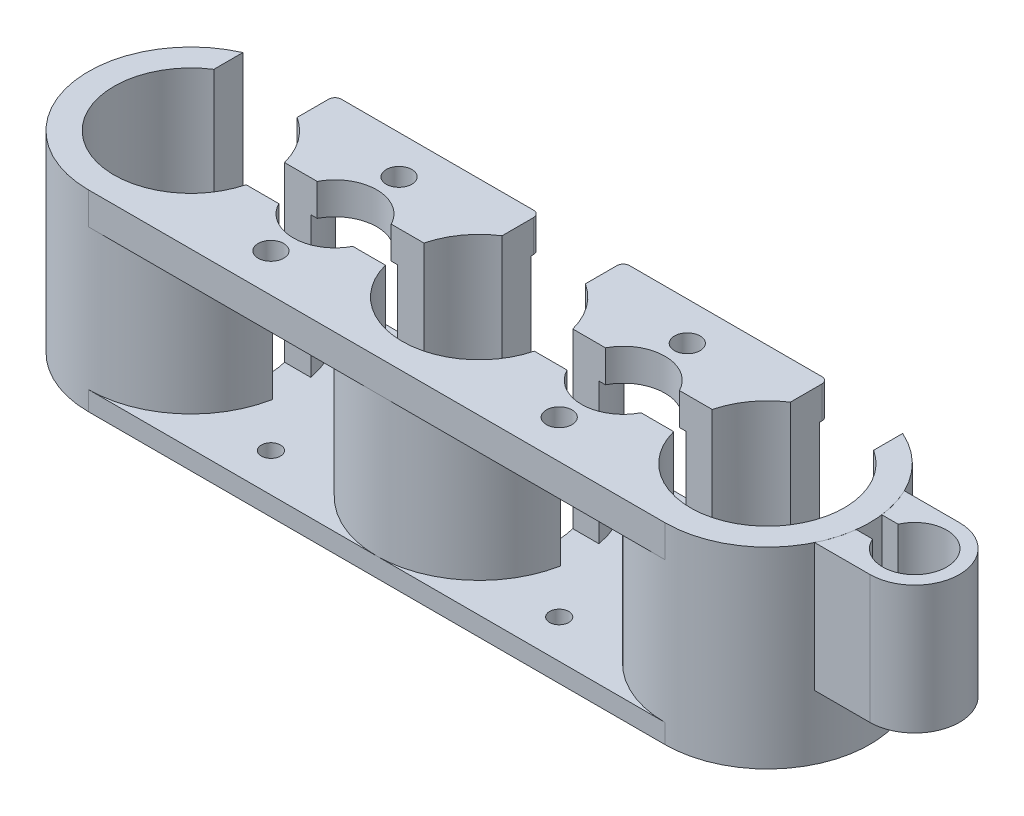
from build123d import *

# Parameters (mm, degrees)
SKETCH1_R               = 16
SKETCH1_R_2             = 12
BOSS_EXTRUDE1_DEPTH     = 30
BOSS_EXTRUDE1_2_DEPTH   = 30
BOSS_EXTRUDE1_3_DEPTH   = 30
BOSS_EXTRUDE2_DEPTH     = 3
BOSS_EXTRUDE3_DEPTH     = 20
SKETCH5_R               = 1.5
CUT_EXTRUDE4_DEPTH      = 10
BOSS_EXTRUDE4_START     = -5
BOSS_EXTRUDE4_OUTLINE_R = 2
BOSS_EXTRUDE4_DEPTH     = 5
LPATTERN6_COUNT         = 2
LPATTERN6_PITCH         = 45
SKETCH6_W               = 13
SKETCH6_H               = 20
SKETCH6_W_2             = 77
SKETCH6_H_2             = 6
CUT_EXTRUDE6_DEPTH      = 27
FILLET20_R              = 1
FILLET21_R              = 6


# Read off the part's stored shape, not the designer's step: Boss-Extrude4
with BuildPart() as part:
    # Sketch1 → Boss-Extrude1 (new body)
    with BuildSketch(Plane(origin=(0, 0, 0), x_dir=(1, 0, 0), z_dir=(0, 1, 0))):
        with Locations(Location((0, 0, 0), (0, 0, 270))):
            Circle(SKETCH1_R)
        with Locations(Location((0, 0, 0), (0, 0, 270))):
            Circle(SKETCH1_R_2, mode=Mode.SUBTRACT)
    extrude(amount=BOSS_EXTRUDE1_DEPTH)



with BuildPart() as body_2:
    # Sketch1 → Boss-Extrude1 2 (new body)
    with BuildSketch(Plane(origin=(0, 0, 0), x_dir=(1, 0, 0), z_dir=(0, 1, 0))):
        with Locations(Location((-45, 0, 0), (0, 0, 270))):
            Circle(SKETCH1_R)
        with Locations(Location((-45, 0, 0), (0, 0, 270))):
            Circle(SKETCH1_R_2, mode=Mode.SUBTRACT)
    extrude(amount=BOSS_EXTRUDE1_2_DEPTH)


with BuildPart() as body_3:
    # Sketch1 → Boss-Extrude1 3 (new body)
    with BuildSketch(Plane(origin=(0, 0, 0), x_dir=(1, 0, 0), z_dir=(0, 1, 0))):
        with Locations(Location((-90, 0, 0), (0, 0, 270))):
            Circle(SKETCH1_R)
        with Locations(Location((-90, 0, 0), (0, 0, 270))):
            Circle(SKETCH1_R_2, mode=Mode.SUBTRACT)
    extrude(amount=BOSS_EXTRUDE1_3_DEPTH)


with BuildPart() as part_1:
    add(part.part)

    add(body_2.part)  # Boss-Extrude2 merges body 2

    add(body_3.part)  # Boss-Extrude2 merges body 3
    # Sketch2 → Boss-Extrude2 (add)
    with BuildSketch(Plane(origin=(0, 0, 0), x_dir=(1, 0, 0), z_dir=(0, 1, 0))):
        with BuildLine():
            Line((-61, 0), (-74, 0))
            ThreePointArc((-74, 0), (-78.686291501, -11.313708499), (-90, -16))
            Line((-90, -16), (-45, -16))
            ThreePointArc((-45, -16), (-56.313708499, -11.313708499), (-61, 0))
        make_face()
        with BuildLine():
            Line((0, 16), (-45, 16))
            ThreePointArc((-45, 16), (-33.686291501, 11.313708499), (-29, 0))
            Line((-29, 0), (-16, 0))
            ThreePointArc((-16, 0), (-11.313708499, 11.313708499), (0, 16))
        make_face()
        with BuildLine():
            ThreePointArc((-29, 0), (-33.686291501, -11.313708499), (-45, -16))
            Line((-45, -16), (0, -16))
            ThreePointArc((0, -16), (-11.313708499, -11.313708499), (-16, 0))
            Line((-16, 0), (-29, 0))
        make_face()
        with BuildLine():
            ThreePointArc((-90, 16), (-78.686291501, 11.313708499), (-74, 0))
            Line((-74, 0), (-61, 0))
            ThreePointArc((-61, 0), (-56.313708499, 11.313708499), (-45, 16))
            Line((-45, 16), (-90, 16))
        make_face()
    extrude(amount=BOSS_EXTRUDE2_DEPTH)

    # Sketch5 → Cut-Extrude4 (cut)
    with BuildSketch(Plane.XZ):
        with Locations(Location((-67.5, 10, 0), (0, 0, 270))):
            Circle(SKETCH5_R)
        with Locations(Location((-67.5, -10, 0), (0, 0, 90))):
            Circle(SKETCH5_R)
        with Locations(Location((-22.5, -10, 0), (0, 0, 270))):
            Circle(SKETCH5_R)
        with Locations(Location((-22.5, 10, 0), (0, 0, 90))):
            Circle(SKETCH5_R)
    extrude(amount=-CUT_EXTRUDE4_DEPTH, mode=Mode.SUBTRACT)

    # Boss-Extrude4 outline → Boss-Extrude4 (add)
    # profile 1 of 2: a face of its own
    with BuildSketch(Plane(origin=(0, 30, 0), x_dir=(1, 0, 0), z_dir=(0, 1, 0)).offset(BOSS_EXTRUDE4_START)):
        with BuildLine():
            ThreePointArc((-74.000004565, -0.012086763), (-78.690565624, -11.317981008), (-90, -16))
            Line((-90, -16), (-45, -16))
            ThreePointArc((-45, -16), (-56.309434376, -11.317981008), (-60.999995435, -0.012086763))
            ThreePointArc((-60.999995435, -0.012086763), (-67.5, -6.517003435), (-74.000004565, -0.012086763))
        make_face()
        with Locations((-67.5, -10)):
            Circle(BOSS_EXTRUDE4_OUTLINE_R, mode=Mode.SUBTRACT)
    # profile 2 of 2: a face of its own
    with BuildSketch(Plane(origin=(0, 30, 0), x_dir=(1, 0, 0), z_dir=(0, 1, 0)).offset(BOSS_EXTRUDE4_START)):
        with BuildLine():
            Line((-45, 16), (-90, 16))
            ThreePointArc((-90, 16), (-78.690565624, 11.317981008), (-74.000004565, 0.012086763))
            ThreePointArc((-74.000004565, 0.012086763), (-67.5, 6.517003435), (-60.999995435, 0.012086763))
            ThreePointArc((-60.999995435, 0.012086763), (-56.309434376, 11.317981008), (-45, 16))
        make_face()
        with Locations((-67.5, 10)):
            Circle(BOSS_EXTRUDE4_OUTLINE_R, mode=Mode.SUBTRACT)
    boss_extrude4 = extrude(amount=BOSS_EXTRUDE4_DEPTH)

    # LPattern6: Boss-Extrude4 ×2
    with Locations(*[(i * LPATTERN6_PITCH, 0, 0) for i in range(1, LPATTERN6_COUNT)]):
        add(boss_extrude4)

    # Sketch6 → Cut-Extrude6 (cut)
    with BuildSketch(Plane(origin=(0, 30, 0), x_dir=(1, 0, 0), z_dir=(0, 1, 0))):
        with Locations((-45, 10)):
            Rectangle(SKETCH6_W, SKETCH6_H)
        with Locations((0, 10)):
            Rectangle(SKETCH6_W, SKETCH6_H)
        with Locations((-90, 10)):
            Rectangle(SKETCH6_W, SKETCH6_H)
        with Locations((-45, 0)):
            Rectangle(SKETCH6_W_2, SKETCH6_H_2)
    extrude(amount=-CUT_EXTRUDE6_DEPTH, mode=Mode.SUBTRACT)

    # Fillet20
    fillet20_edges = [part_1.edges().sort_by_distance(p)[0] for p in [
        (-51.5, 27.5, -16),
        (-6.5, 27.5, -16),
        (-38.5, 27.5, -16),
        (-83.5, 27.5, -16),
    ]]
    fillet(fillet20_edges, radius=FILLET20_R)

    # Fillet21
    # the kernel refuses this fillet: 6 mm, written as the material it adds along each edge
    with BuildSketch(Plane(origin=(-38.5, 3, 4.912879499), x_dir=(0, 1, 0), z_dir=(0, 0, -1))) as fillet21_piece_1_section:
        with BuildLine():
            CenterArc((FILLET21_R, -FILLET21_R), FILLET21_R, 90, 90)
            Line((0, -FILLET21_R), (0, 0))
            Line((0, 0), (FILLET21_R, 0))
        make_face()
    fillet21_piece_1 = extrude(amount=34.533071016, mode=Mode.PRIVATE)
    fillet21_piece_1 = fillet21_piece_1 - Plane(origin=(-45, 4.386828821, 0), x_dir=(0, 0, 1), z_dir=(0, -1, 0)) * Cylinder(12, 94, mode=Mode.PRIVATE)
    fillet21_piece_1 = fillet21_piece_1 & Plane(origin=(-45, 4.386828821, 0), x_dir=(0, 0, 1), z_dir=(0, -1, 0)) * Cylinder(16, 94, mode=Mode.PRIVATE)
    add(fillet21_piece_1)
    with BuildSketch(Plane(origin=(6.5, 3, 4.912879499), x_dir=(-1, 0, 0), z_dir=(0, 0, -1))) as fillet21_piece_2_section:
        with BuildLine():
            CenterArc((FILLET21_R, FILLET21_R), FILLET21_R, 180, 90)
            Line((0, FILLET21_R), (0, 0))
            Line((0, 0), (FILLET21_R, 0))
        make_face()
    fillet21_piece_2 = extrude(amount=34.533071016, mode=Mode.PRIVATE)
    fillet21_piece_2 = fillet21_piece_2 - Plane(origin=(0, 4.386829335, 0), x_dir=(0, 0, 1), z_dir=(0, -1, 0)) * Cylinder(12, 94, mode=Mode.PRIVATE)
    fillet21_piece_2 = fillet21_piece_2 & Plane(origin=(0, 4.386829335, 0), x_dir=(0, 0, 1), z_dir=(0, -1, 0)) * Cylinder(16, 94, mode=Mode.PRIVATE)
    add(fillet21_piece_2)
    with BuildSketch(Plane(origin=(-83.5, 3, 4.912879499), x_dir=(-1, 0, 0), z_dir=(0, 0, -1))) as fillet21_piece_3_section:
        with BuildLine():
            CenterArc((FILLET21_R, FILLET21_R), FILLET21_R, 180, 90)
            Line((0, FILLET21_R), (0, 0))
            Line((0, 0), (FILLET21_R, 0))
        make_face()
    fillet21_piece_3 = extrude(amount=34.533071016, mode=Mode.PRIVATE)
    fillet21_piece_3 = fillet21_piece_3 - Plane(origin=(-90, 4.386829335, 0), x_dir=(0, 0, 1), z_dir=(0, -1, 0)) * Cylinder(12, 94, mode=Mode.PRIVATE)
    fillet21_piece_3 = fillet21_piece_3 & Plane(origin=(-90, 4.386829335, 0), x_dir=(0, 0, 1), z_dir=(0, -1, 0)) * Cylinder(16, 94, mode=Mode.PRIVATE)
    add(fillet21_piece_3)
    with BuildSketch(Plane(origin=(-96.5, 3, -29.620191517), x_dir=(1, 0, 0), z_dir=(0, 0, 1))) as fillet21_piece_4_section:
        with BuildLine():
            CenterArc((FILLET21_R, FILLET21_R), FILLET21_R, 180, 90)
            Line((0, FILLET21_R), (0, 0))
            Line((0, 0), (FILLET21_R, 0))
        make_face()
    fillet21_piece_4 = extrude(amount=34.533071016, mode=Mode.PRIVATE)
    fillet21_piece_4 = fillet21_piece_4 & Plane(origin=(-90, 4.386829274, 0), x_dir=(0, 0, 1), z_dir=(0, -1, 0)) * Cylinder(16, 94, mode=Mode.PRIVATE)
    fillet21_piece_4 = fillet21_piece_4 - Plane(origin=(-90, 4.386829274, 0), x_dir=(0, 0, 1), z_dir=(0, -1, 0)) * Cylinder(12, 94, mode=Mode.PRIVATE)
    add(fillet21_piece_4)
    with BuildSketch(Plane(origin=(-51.5, 3, -29.620191517), x_dir=(1, 0, 0), z_dir=(0, 0, 1))) as fillet21_piece_5_section:
        with BuildLine():
            CenterArc((FILLET21_R, FILLET21_R), FILLET21_R, 180, 90)
            Line((0, FILLET21_R), (0, 0))
            Line((0, 0), (FILLET21_R, 0))
        make_face()
    fillet21_piece_5 = extrude(amount=34.533071016, mode=Mode.PRIVATE)
    fillet21_piece_5 = fillet21_piece_5 & Plane(origin=(-45, 4.386829361, 0), x_dir=(0, 0, 1), z_dir=(0, -1, 0)) * Cylinder(16, 94, mode=Mode.PRIVATE)
    fillet21_piece_5 = fillet21_piece_5 - Plane(origin=(-45, 4.386829361, 0), x_dir=(0, 0, 1), z_dir=(0, -1, 0)) * Cylinder(12, 94, mode=Mode.PRIVATE)
    add(fillet21_piece_5)
    with BuildSketch(Plane(origin=(-6.5, 3, -29.620191517), x_dir=(0, 1, 0), z_dir=(0, 0, 1))) as fillet21_piece_6_section:
        with BuildLine():
            CenterArc((FILLET21_R, -FILLET21_R), FILLET21_R, 90, 90)
            Line((0, -FILLET21_R), (0, 0))
            Line((0, 0), (FILLET21_R, 0))
        make_face()
    fillet21_piece_6 = extrude(amount=34.533071016, mode=Mode.PRIVATE)
    fillet21_piece_6 = fillet21_piece_6 - Plane(origin=(0, 4.386829879, 0), x_dir=(0, 0, 1), z_dir=(0, -1, 0)) * Cylinder(12, 94, mode=Mode.PRIVATE)
    fillet21_piece_6 = fillet21_piece_6 & Plane(origin=(0, 4.386829879, 0), x_dir=(0, 0, 1), z_dir=(0, -1, 0)) * Cylinder(16, 94, mode=Mode.PRIVATE)
    add(fillet21_piece_6)


with BuildPart() as body_2_2:
    # Sketch3 → Boss-Extrude3 (new body)
    with BuildSketch(Plane(origin=(0, 30, 0), x_dir=(1, 0, 0), z_dir=(0, 1, 0))):
        with BuildLine():
            ThreePointArc((30, 0), (27.949747468, 4.949747468), (23, 7))
            ThreePointArc((23, 7), (18.816699867, 5.61248608), (16.291796068, 2))
            Line((16.291796068, 2), (18.417424305, 2))
            ThreePointArc((18.417424305, 2), (24.021548218, 4.894531565), (28, 0))
            ThreePointArc((28, 0), (24.021548218, -4.894531565), (18.417424305, -2))
            Line((18.417424305, -2), (16.291796068, -2))
            ThreePointArc((16.291796068, -2), (18.816699867, -5.61248608), (23, -7))
            ThreePointArc((23, -7), (27.949747468, -4.949747468), (30, 0))
        make_face()
        with BuildLine():
            ThreePointArc((15.874507866, -2), (15.336140253, -4.561008895), (14.38749457, -7))
            Line((14.38749457, -7), (23, -7))
            ThreePointArc((23, -7), (18.816699867, -5.61248608), (16.291796068, -2))
            Line((16.291796068, -2), (15.874507866, -2))
        make_face()
        with BuildLine():
            Line((23, 7), (14.38749457, 7))
            ThreePointArc((14.38749457, 7), (15.336140253, 4.561008895), (15.874507866, 2))
            Line((15.874507866, 2), (16.291796068, 2))
            ThreePointArc((16.291796068, 2), (18.816699867, 5.61248608), (23, 7))
        make_face()
    extrude(amount=-BOSS_EXTRUDE3_DEPTH)


solid = Compound([part_1.part, body_2_2.part])
